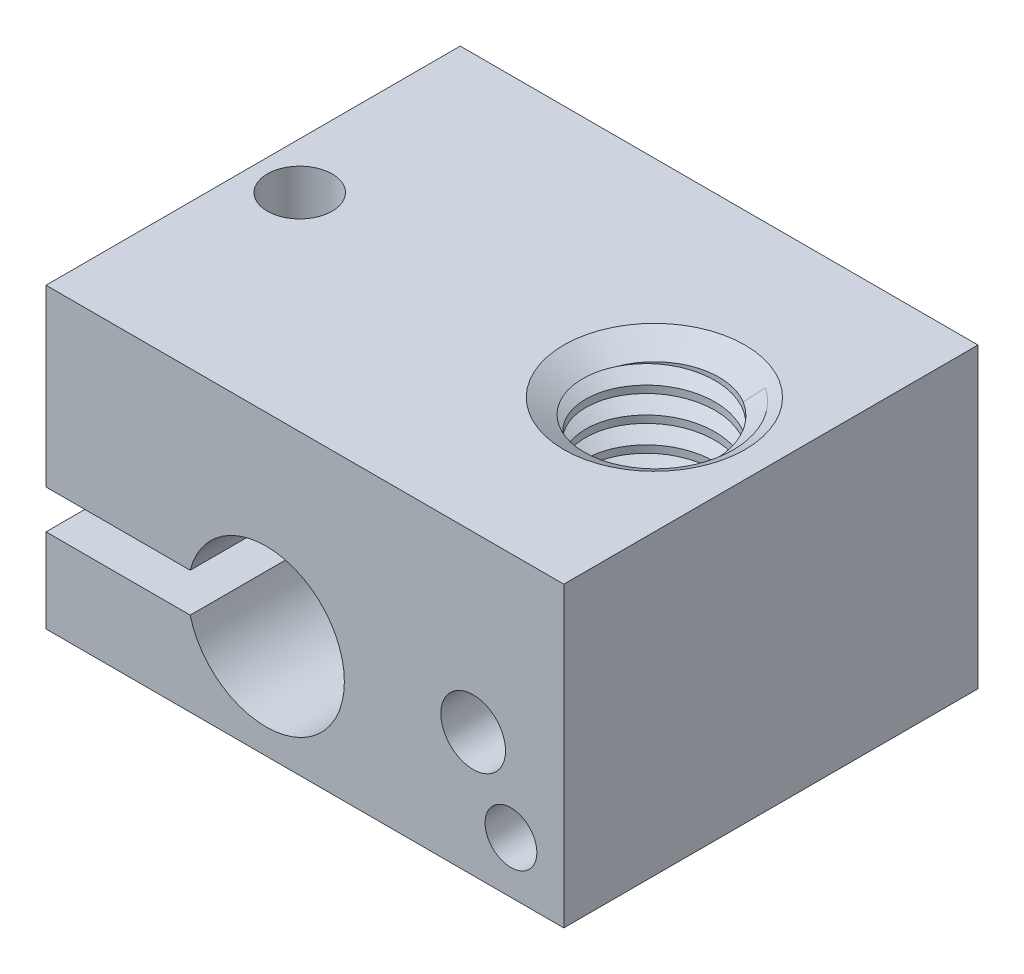
from build123d import *

# Parameters (mm, degrees)
SKETCH1_W           = 20
SKETCH1_H           = 16
BOSS_EXTRUDE1_DEPTH = 5.75
CUT_EXTRUDE1_REACH  = 19.212
SKETCH2_R           = 2.5
SKETCH2_R_2         = 1.25
CUT_EXTRUDE2_REACH  = 21.725
SKETCH4_R           = 1
SKETCH4_R_2         = 1.25
CUT_EXTRUDE3_DEPTH  = 3.4
SKETCH5_R           = 0.8
CUT_EXTRUDE4_DEPTH  = 4.4
CHAMFER1_SIZE       = 1
CHAMFER1_SIZE2      = 0.577350269
CUT_SWEEP1_PITCH    = 1


with BuildPart() as part:
    # Sketch1 → Boss-Extrude1 (new, symmetric)
    with BuildSketch(Plane(origin=(0, 0, 0), x_dir=(1, 0, 0), z_dir=(0, 1, 0))):
        Rectangle(SKETCH1_W, SKETCH1_H)
    extrude(amount=BOSS_EXTRUDE1_DEPTH, both=True)

    # Sketch2 → Cut-Extrude1 (cut, up to next)
    with BuildSketch(Plane(origin=(0, 5.75, 0), x_dir=(1, 0, 0), z_dir=(0, 1, 0)), mode=Mode.PRIVATE) as cut_extrude1_sk1:
        with Locations(Location((5.5, 0, 0), (0, 0, 270))):
            Circle(SKETCH2_R)
    cut_extrude1_tool1 = extrude(cut_extrude1_sk1.sketch, amount=-CUT_EXTRUDE1_REACH, mode=Mode.PRIVATE) & part.part
    # Sketch2 → Cut-Extrude1 (cut, up to next)
    with BuildSketch(Plane(origin=(0, 5.75, 0), x_dir=(1, 0, 0), z_dir=(0, 1, 0)), mode=Mode.PRIVATE) as cut_extrude1_sk2:
        with Locations(Location((-8.2, 0, 0), (0, 0, 270))):
            Circle(SKETCH2_R_2)
    cut_extrude1_tool2 = extrude(cut_extrude1_sk2.sketch, amount=-CUT_EXTRUDE1_REACH, mode=Mode.PRIVATE) & part.part
    add(cut_extrude1_tool1.solids().sort_by_distance((5.5, 5.75, 0))[0], mode=Mode.SUBTRACT)
    add(cut_extrude1_tool2.solids().sort_by_distance((-8.2, 5.75, 0))[0], mode=Mode.SUBTRACT)

    # Sketch3 → Cut-Extrude2 (cut, up to next)
    with BuildSketch(Plane.XY.offset(8), mode=Mode.PRIVATE) as cut_extrude2_sk1:
        with BuildLine():
            Line((-15.147501238, -1.75), (-15.147501238, -1))
            Line((-15.147501238, -1), (-4.43055029, -1))
            ThreePointArc((-4.43055029, -1), (1.525, -1.75), (-4.43055029, -2.5))
            Line((-4.43055029, -2.5), (-15.147501238, -2.5))
            Line((-15.147501238, -2.5), (-15.147501238, -1.75))
        make_face()
    cut_extrude2_tool1 = extrude(cut_extrude2_sk1.sketch, amount=-CUT_EXTRUDE2_REACH, mode=Mode.PRIVATE) & part.part
    add(cut_extrude2_tool1.solids().sort_by_distance((-4.472808, -1.75, 8))[0], mode=Mode.SUBTRACT)

    # Sketch4 → Cut-Extrude3 (cut)
    with BuildSketch(Plane.XY.offset(8)):
        with Locations((7.960115599, -3.75)):
            Circle(SKETCH4_R)
        with Locations((6.5, -0.95)):
            Circle(SKETCH4_R_2)
    extrude(amount=-CUT_EXTRUDE3_DEPTH, mode=Mode.SUBTRACT)

    # Sketch5 → Cut-Extrude4 (cut)
    with BuildSketch(Plane.XY.offset(8)):
        with Locations((7.960115599, -3.75)):
            Circle(SKETCH5_R)
    extrude(amount=-CUT_EXTRUDE4_DEPTH, mode=Mode.SUBTRACT)

    # Chamfer1
    chamfer1_edges = [part.edges().sort_by_distance(p)[0] for p in [
        (5.5, 5.75, -2.5),
    ]]
    chamfer1_side = [part.faces().sort_by_distance(p)[0] for p in [
        (-0.229274481, 5.75, 0),
    ]]
    chamfer(chamfer1_edges, length=CHAMFER1_SIZE, length2=CHAMFER1_SIZE2, reference=chamfer1_side[0])

    # Cut-Sweep1: the profile of Sketch7 screwed along a right-hand helix of 20 turns, 8 arcs to a turn; built about Z, then put on its axis
    cut_sweep1_z = Axis((0, 0, 0), (0, 0, 1))
    cut_sweep1_corners = [(-2.208234359, 2.208234359, 2.380783477), (-1.589738199, 1.589738199, 1.875783477), (-1.589738199, 1.589738199, 2.885783477)]
    with BuildLine(mode=Mode.PRIVATE) as cut_sweep1_profile:
        Line(cut_sweep1_corners[0], cut_sweep1_corners[1])
        Line(cut_sweep1_corners[1], cut_sweep1_corners[2])
        Line(cut_sweep1_corners[2], cut_sweep1_corners[0])
    cut_sweep1_cap = Face(cut_sweep1_profile.wire())
    cut_sweep1_turn_angles = [0, 22.5, 45, 67.5, 90, 112.5, 135, 157.5, 180, 202.5, 225, 247.5, 270, 292.5, 315, 337.5, 360]
    cut_sweep1_turn_weights = [1, 0.9238795325112867, 1, 0.9238795325112867, 1, 0.9238795325112867, 1, 0.9238795325112867, 1, 0.9238795325112867, 1, 0.9238795325112867, 1, 0.9238795325112867, 1, 0.9238795325112867, 1]
    cut_sweep1_turn_rails = [Edge.make_bspline([Vector(p[0], p[1], 0).rotate(cut_sweep1_z, cut_sweep1_turn_angles[k]) / cut_sweep1_turn_weights[k] + Vector(0, 0, p[2] + CUT_SWEEP1_PITCH * cut_sweep1_turn_angles[k] / 360) for k in range(17)], [0, 0, 0, 1, 1, 2, 2, 3, 3, 4, 4, 5, 5, 6, 6, 7, 7, 8, 8, 8], 2, cut_sweep1_turn_weights) for p in cut_sweep1_corners]
    cut_sweep1_turn_sides = [Face.make_surface_from_curves(cut_sweep1_turn_rails[p[0]], cut_sweep1_turn_rails[p[1]]) for p in [(0, 1), (1, 2), (2, 0)]]
    cut_sweep1 = Plane(origin=(5.5, 8.75, 0), x_dir=(-0.7071067811865537, 0, -0.7071067811865414), z_dir=(0, -1, 0)) * Solid(Shell([*[p.moved(Location((0, 0, CUT_SWEEP1_PITCH * i))) for i in range(20) for p in cut_sweep1_turn_sides], cut_sweep1_cap, cut_sweep1_cap.rotate(cut_sweep1_z, 7200).moved(Location((0, 0, CUT_SWEEP1_PITCH * 7200 / 360)))]))
    add(cut_sweep1, mode=Mode.SUBTRACT)


solid = part.part
